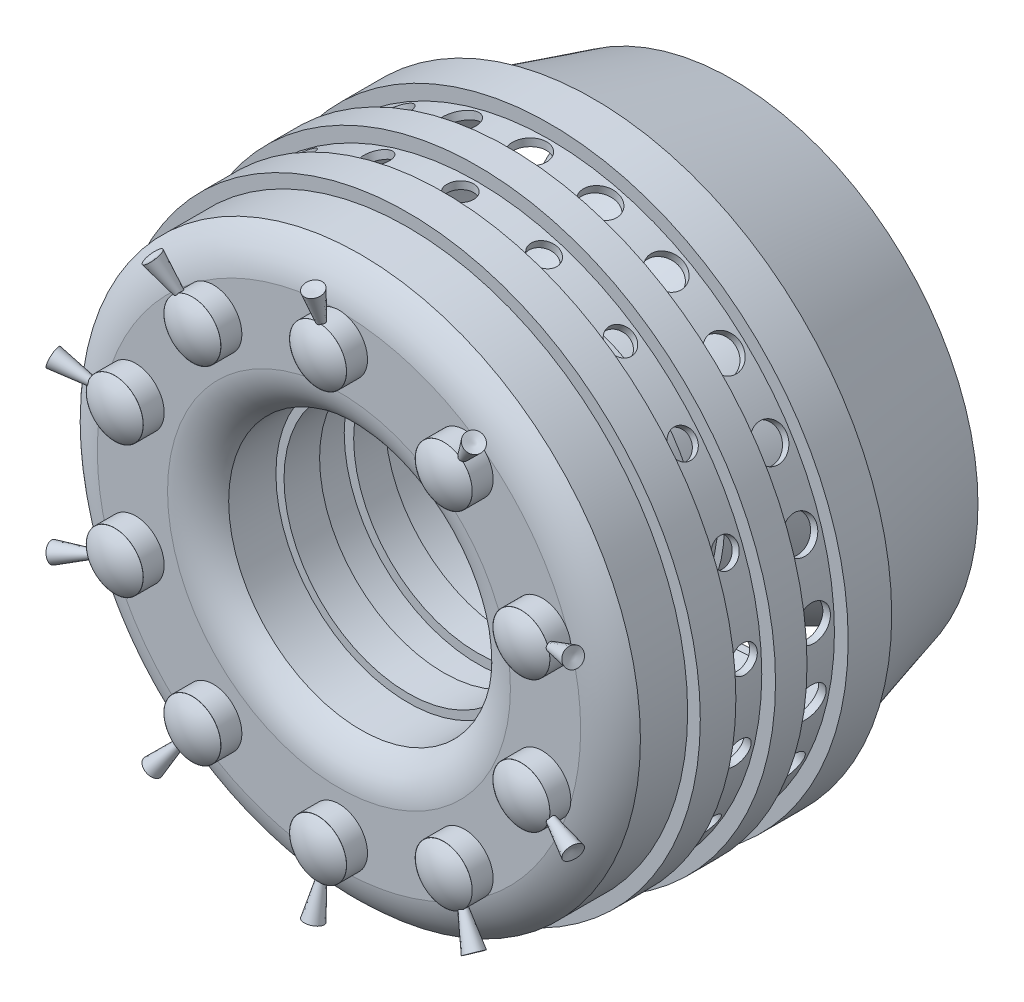
from build123d import *
from build123d.topology import SkipClean

# Parameters (mm, degrees)
REVOLVE_THIN5_START         = -3314.225087176
REVOLVE_THIN5_OUTLINE_R     = 75
REVOLVE_THIN5_OUTLINE_R_2   = 65
REVOLVE_THIN5_OUTLINE_R_3   = 30
REVOLVE_THIN5_OUTLINE_R_4   = 20
REVOLVE_THIN5_DEPTH         = 55.254217774
REVOLVE_THIN5_START_2       = -3268.970869402
REVOLVE_THIN5_2_OUTLINE_R   = 65
REVOLVE_THIN5_2_OUTLINE_R_2 = 30
REVOLVE_THIN5_2_DEPTH       = 10
CUT_EXTRUDE1_START          = -50
SKETCH64_R                  = 20
CUT_EXTRUDE1_DEPTH          = 50
CIRPATTERN12_COUNT          = 10
SKETCH66_R                  = 35
CUT_EXTRUDE2_DEPTH          = 50
CIRPATTERN13_COUNT          = 21
SKETCH67_R                  = 45
CUT_EXTRUDE3_DEPTH          = 50
CIRPATTERN14_COUNT          = 25
CIRPATTERN11_COUNT          = 10


with BuildPart() as part:
    # Sketch57 → Revolve8 (revolve)
    with BuildSketch(Plane(origin=(0, 0, 0), x_dir=(0, 0, -1), z_dir=(1, 0, 0)), mode=Mode.PRIVATE) as revolve8_sk:
        with BuildLine():
            Line((3313.970869402, 635.185367669), (3313.970869402, 450.613569592))
            ThreePointArc((3313.970869402, 450.613569592), (3330.464697472, 392.195266045), (3371.390720947, 347.364415547))
            Line((3371.390720947, 347.364415547), (3495.530720947, 347.364415547))
            Line((3495.530720947, 347.364415547), (3495.530720947, 326.0458224))
            Line((3495.530720947, 326.0458224), (3589.036217545, 326.0458224))
            Line((3589.036217545, 326.0458224), (3589.036217545, 350.834376424))
            Line((3589.036217545, 350.834376424), (3678.575697753, 350.834376424))
            Line((3678.575697753, 350.834376424), (3678.575697753, 326.0458224))
            Line((3678.575697753, 326.0458224), (3761.257239161, 326.0458224))
            Line((3761.257239161, 326.0458224), (3761.257239161, 350.834376424))
            Line((3761.257239161, 350.834376424), (3869.521007678, 350.834376424))
            Line((3869.521007678, 350.834376424), (3869.521007678, 326.0458224))
            Line((3869.521007678, 326.0458224), (3983.007757142, 326.0458224))
            Line((3983.007757142, 326.0458224), (3983.007757142, 350.834376424))
            Line((3983.007757142, 350.834376424), (4349.099210395, 514.512108381))
            Line((4349.099210395, 514.512108381), (4349.099210395, 527.478140078))
            Line((4349.099210395, 527.478140078), (4329.099210395, 527.478140078))
            Line((4329.099210395, 527.478140078), (3963.007757142, 363.800408121))
            Line((3963.007757142, 363.800408121), (3963.007757142, 346.0458224))
            Line((3963.007757142, 346.0458224), (3889.521007678, 346.0458224))
            Line((3889.521007678, 346.0458224), (3889.521007678, 370.834376424))
            Line((3889.521007678, 370.834376424), (3741.257239161, 370.834376424))
            Line((3741.257239161, 370.834376424), (3741.257239161, 346.0458224))
            Line((3741.257239161, 346.0458224), (3698.575697753, 346.0458224))
            Line((3698.575697753, 346.0458224), (3698.575697753, 370.834376424))
            Line((3698.575697753, 370.834376424), (3569.036217545, 370.834376424))
            Line((3569.036217545, 370.834376424), (3569.036217545, 346.0458224))
            Line((3569.036217545, 346.0458224), (3515.530720947, 346.0458224))
            Line((3515.530720947, 346.0458224), (3515.530720947, 367.364415547))
            Line((3515.530720947, 367.364415547), (3377.841646399, 367.364415547))
            ThreePointArc((3377.841646399, 367.364415547), (3346.629410374, 404.349239383), (3333.970869402, 451.059433262))
            Line((3333.970869402, 451.059433262), (3333.970869402, 633.657919706))
            ThreePointArc((3333.970869402, 633.657919706), (3349.040773549, 678.465399898), (3377.952225996, 715.86780904))
            Line((3377.952225996, 715.86780904), (3514.564708375, 715.86780904))
            Line((3514.564708375, 715.86780904), (3514.564708375, 749.083818894))
            Line((3514.564708375, 749.083818894), (3568.070204974, 749.083818894))
            Line((3568.070204974, 749.083818894), (3568.070204974, 727.617700225))
            Line((3568.070204974, 727.617700225), (3697.609685181, 727.617700225))
            Line((3697.609685181, 727.617700225), (3697.609685181, 763.766300886))
            Line((3697.609685181, 763.766300886), (3740.355782999, 763.766300886))
            Line((3740.355782999, 763.766300886), (3740.355782999, 727.617700225))
            Line((3740.355782999, 727.617700225), (3888.619551517, 727.617700225))
            Line((3888.619551517, 727.617700225), (3888.619551517, 763.766300886))
            Line((3888.619551517, 763.766300886), (3963.007757142, 763.766300886))
            Line((3963.007757142, 763.766300886), (3963.007757142, 732.475644391))
            Line((3963.007757142, 732.475644391), (4329.099210395, 629.28877445))
            Line((4329.099210395, 629.28877445), (4349.099210395, 629.28877445))
            Line((4349.099210395, 629.28877445), (4349.099210395, 644.430830284))
            Line((4349.099210395, 644.430830284), (3983.007757142, 747.617700225))
            Line((3983.007757142, 747.617700225), (3983.007757142, 783.766300886))
            Line((3983.007757142, 783.766300886), (3868.619551517, 783.766300886))
            Line((3868.619551517, 783.766300886), (3868.619551517, 747.617700225))
            Line((3868.619551517, 747.617700225), (3760.355782999, 747.617700225))
            Line((3760.355782999, 747.617700225), (3760.355782999, 783.766300886))
            Line((3760.355782999, 783.766300886), (3677.609685181, 783.766300886))
            Line((3677.609685181, 783.766300886), (3677.609685181, 747.617700225))
            Line((3677.609685181, 747.617700225), (3588.070204974, 747.617700225))
            Line((3588.070204974, 747.617700225), (3588.070204974, 769.083818894))
            Line((3588.070204974, 769.083818894), (3494.564708375, 769.083818894))
            Line((3494.564708375, 769.083818894), (3494.564708375, 735.86780904))
            Line((3494.564708375, 735.86780904), (3370.420105969, 735.86780904))
            ThreePointArc((3370.420105969, 735.86780904), (3332.946354233, 690.712264378), (3313.970869402, 635.185367669))
        make_face()
    revolve(revolve8_sk.sketch.rotate(Axis((0, 0, 0), (0, 0, -1)), 90), axis=Axis((0, 0, 0), (0, 0, -1)))

    # Revolve-Thin5: read off the stored shape, not the designer's step
    # Revolve-Thin5 outline → Revolve-Thin5 (add)
    # profile 1 of 2: a face of its own
    with BuildSketch(Plane.XY.offset(REVOLVE_THIN5_START)):
        with Locations((0, 561.836881651)):
            Circle(REVOLVE_THIN5_OUTLINE_R)
        with Locations((0, 561.836881651)):
            Circle(REVOLVE_THIN5_OUTLINE_R_2, mode=Mode.SUBTRACT)
    # profile 2 of 2: a face of its own
    with BuildSketch(Plane.XY.offset(REVOLVE_THIN5_START)):
        with Locations((0, 561.836881651)):
            Circle(REVOLVE_THIN5_OUTLINE_R_3)
        with Locations((0, 561.836881651)):
            Circle(REVOLVE_THIN5_OUTLINE_R_4, mode=Mode.SUBTRACT)
    revolve_thin5 = extrude(amount=REVOLVE_THIN5_DEPTH)

    # Revolve-Thin5 2 outline → Revolve-Thin5 2 (add)
    with BuildSketch(Plane.XY.offset(REVOLVE_THIN5_START_2)):
        with Locations((0, 561.836881651)):
            Circle(REVOLVE_THIN5_2_OUTLINE_R)
        with Locations((0, 561.836881651)):
            Circle(REVOLVE_THIN5_2_OUTLINE_R_2, mode=Mode.SUBTRACT)
    revolve_thin5_2 = extrude(amount=REVOLVE_THIN5_2_DEPTH)

    # Sketch64 → Cut-Extrude1 (cut)
    with BuildSketch(Plane.XY.offset(-3313.970869402).offset(CUT_EXTRUDE1_START)):
        with Locations(Location((0, 561.836881651, 0), (0, 0, 180))):
            Circle(SKETCH64_R)
    cut_extrude1 = extrude(amount=CUT_EXTRUDE1_DEPTH, mode=Mode.SUBTRACT)

    # CirPattern12: Cut-Extrude1 ×10 about axis
    cirpattern12_axis = Axis((0, 0, 0), (0, 0, -1))
    for i in range(1, CIRPATTERN12_COUNT):
        add(cut_extrude1.rotate(cirpattern12_axis, i * 360 / CIRPATTERN12_COUNT), mode=Mode.SUBTRACT)

    # Sketch66 → Cut-Extrude2 (cut)
    with BuildSketch(Plane(origin=(0, 747.617700225, 0), x_dir=(1, 0, 0), z_dir=(0, 1, 0))):
        with Locations(Location((0, 3632.839945077, 0), (0, 0, 270))):
            Circle(SKETCH66_R)
    cut_extrude2 = extrude(amount=-CUT_EXTRUDE2_DEPTH, mode=Mode.SUBTRACT)

    # CirPattern13: Cut-Extrude2 ×21 about axis
    cirpattern13_axis = Axis((0, 0, 0), (0, 0, -1))
    for i in range(1, CIRPATTERN13_COUNT):
        add(cut_extrude2.rotate(cirpattern13_axis, i * 360 / CIRPATTERN13_COUNT), mode=Mode.SUBTRACT)

    # Sketch67 → Cut-Extrude3 (cut)
    with BuildSketch(Plane(origin=(0, 747.617700225, 0), x_dir=(1, 0, 0), z_dir=(0, 1, 0))):
        with Locations(Location((0, 3814.487667258, 0), (0, 0, 270))):
            Circle(SKETCH67_R)
    cut_extrude3 = extrude(amount=-CUT_EXTRUDE3_DEPTH, mode=Mode.SUBTRACT)

    # CirPattern14: Cut-Extrude3 ×25 about axis
    cirpattern14_axis = Axis((0, 0, 0), (0, 0, -1))
    for i in range(1, CIRPATTERN14_COUNT):
        add(cut_extrude3.rotate(cirpattern14_axis, i * 360 / CIRPATTERN14_COUNT), mode=Mode.SUBTRACT)

    # Sketch68 → Revolve12 (revolve)
    with BuildSketch(Plane(origin=(0, 0, 0), x_dir=(0, 0, -1), z_dir=(1, 0, 0))):
        with BuildLine():
            Line((3258.970869402, 561.836881651), (3231.910595237, 561.783406953))
            ThreePointArc((3231.910595237, 561.783406953), (3238.882848005, 601.624466468), (3258.970869402, 636.729932256))
            Line((3258.970869402, 636.729932256), (3258.970869402, 561.836881651))
        make_face()
    revolve12 = revolve(axis=Axis((0, 561.836881651, -3258.970869402), (0, -0.001976129017366447, 0.9999980474551472)))

    # Sketch69 → Revolve16 (revolve)
    with BuildSketch(Plane(origin=(0, 0, 0), x_dir=(0, 0, -1), z_dir=(1, 0, 0)), mode=Mode.PRIVATE) as revolve16_sk:
        Polygon((3247.861797297, 712.207004262), (3277.861411969, 591.836881651), (3281.334700607, 591.836881651), (3269.753454013, 724.083437162), align=None)
    revolve16 = revolve(revolve16_sk.sketch.rotate(Axis((0, 712.207004262, -3247.861797297), (0, -0.9703184810191743, -0.24183061301796002)), 180), axis=Axis((0, 712.207004262, -3247.861797297), (0, -0.9703184810191743, -0.24183061301796002)))

    # CirPattern11: Revolve-Thin5, Revolve-Thin5 2, Revolve12, Revolve16 ×10 about axis
    with SkipClean():  # the faces are left unmerged after this step: merging them gives an invalid solid
        cirpattern11_axis = Axis((0, 0, 0), (0, 0, 1))
        add([revolve_thin5.rotate(cirpattern11_axis, i * 360 / CIRPATTERN11_COUNT) for i in range(1, CIRPATTERN11_COUNT)])
        add([revolve_thin5_2.rotate(cirpattern11_axis, i * 360 / CIRPATTERN11_COUNT) for i in range(1, CIRPATTERN11_COUNT)])
        add([revolve12.rotate(cirpattern11_axis, i * 360 / CIRPATTERN11_COUNT) for i in range(1, CIRPATTERN11_COUNT)])
        add([revolve16.rotate(cirpattern11_axis, i * 360 / CIRPATTERN11_COUNT) for i in range(1, CIRPATTERN11_COUNT)])


solid = part.part
